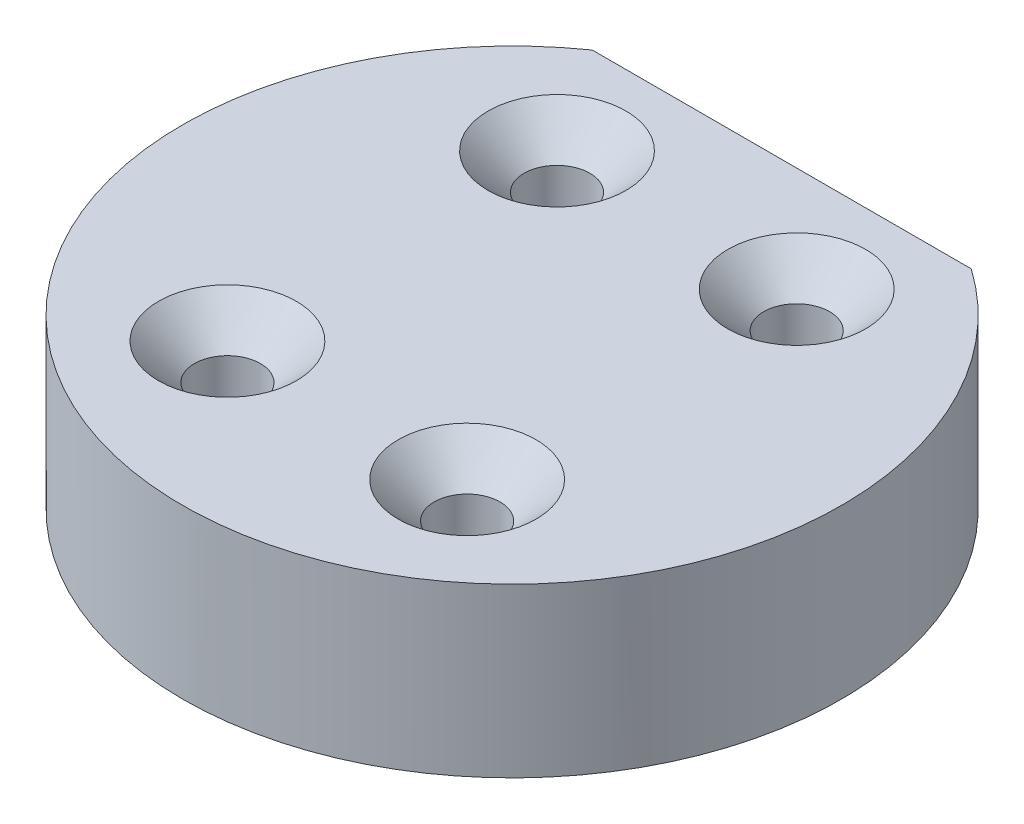
from build123d import *

# Parameters (mm, degrees)
SKETCH1_R           = 27.5
SKETCH1_R_2         = 2.75
BOSS_EXTRUDE1_DEPTH = 14
CHAMFER1_SIZE       = 3
SKETCH2_W           = 55
SKETCH2_H           = 5
CUT_EXTRUDE1_DEPTH  = 7


with BuildPart() as part:
    # Sketch1 → Boss-Extrude1 (new body)
    with BuildSketch(Plane(origin=(0, 0, 0), x_dir=(1, 0, 0), z_dir=(0, 1, 0))):
        Circle(SKETCH1_R)
        with Locations((10, -13.75)):
            Circle(SKETCH1_R_2, mode=Mode.SUBTRACT)
        with Locations((-10, -13.75)):
            Circle(SKETCH1_R_2, mode=Mode.SUBTRACT)
        with Locations((-10, 13.75)):
            Circle(SKETCH1_R_2, mode=Mode.SUBTRACT)
        with Locations((10, 13.75)):
            Circle(SKETCH1_R_2, mode=Mode.SUBTRACT)
    extrude(amount=BOSS_EXTRUDE1_DEPTH)

    # Chamfer1
    chamfer1_edges = [part.edges().sort_by_distance(p)[0] for p in [
        (-12.75, 14, 13.75),
        (7.25, 14, 13.75),
        (7.25, 14, -13.75),
        (-12.75, 14, -13.75),
    ]]
    chamfer(chamfer1_edges, length=CHAMFER1_SIZE)

    # Sketch2 → Cut-Extrude1 (cut)
    with BuildSketch(Plane.XZ.offset(-14)):
        with Locations((0, -25)):
            Rectangle(SKETCH2_W, SKETCH2_H)
    extrude(amount=CUT_EXTRUDE1_DEPTH, mode=Mode.SUBTRACT)


solid = part.part
